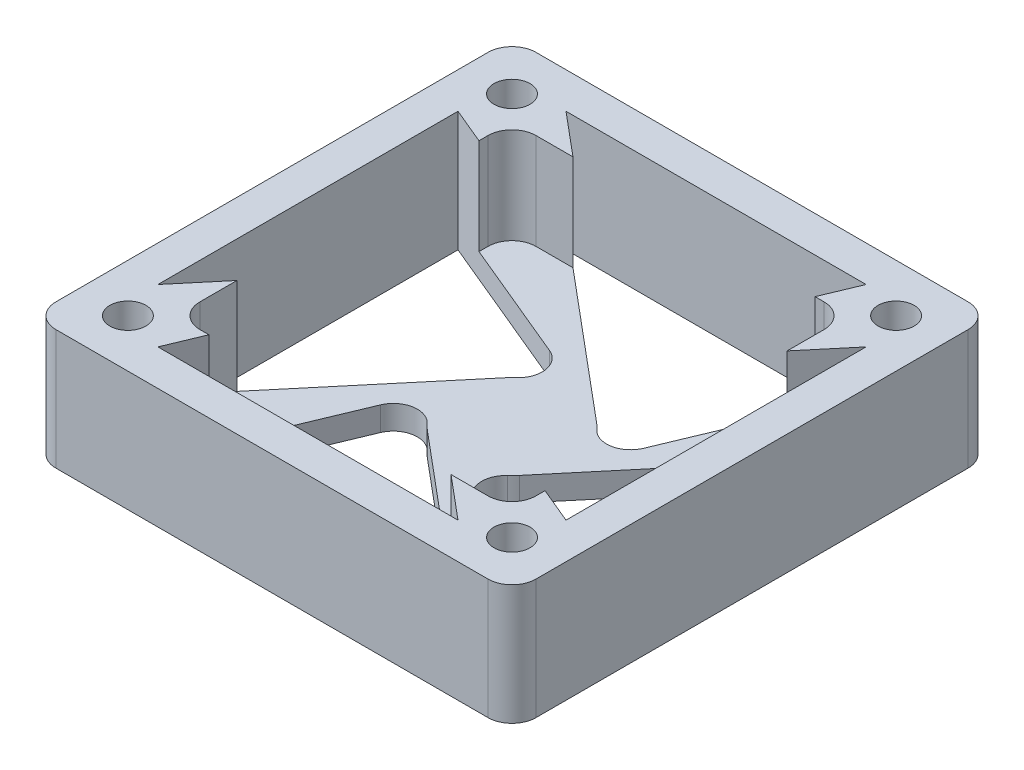
from build123d import *

# Parameters (mm, degrees)
SKETCH_1_W          = 40
SKETCH_1_H          = 40
EXTRUDE_1_DEPTH     = 10
FILLET_1_R          = 2
CUT_EXTRUDE_1_DEPTH = 8
FILLET_2_R          = 2
SKETCH_3_R          = 1.5
SKETCH_3_R_2        = 1.4999999999999978
SKETCH_3_R_3        = 1.500000000000004
SKETCH_3_R_4        = 1.5000000000000042
CUT_EXTRUDE_2_DEPTH = 58.445626465380286
CUT_EXTRUDE_3_DEPTH = 58.445626465380286
FILLET_3_R          = 2


with BuildPart() as part:
    # 草图1 → 凸台-拉伸1 (new body)
    with BuildSketch(Plane(origin=(0, 0, 0), x_dir=(1, 0, 0), z_dir=(0, 1, 0))):
        with Locations((20, 20)):
            Rectangle(SKETCH_1_W, SKETCH_1_H)
    extrude(amount=EXTRUDE_1_DEPTH)

    # 圆角1
    fillet_1_edges = [part.edges().sort_by_distance(p)[0] for p in [
        (0, 5, -40),
        (40, 5, -40),
        (40, 5, 0),
        (0, 5, 0),
    ]]
    fillet(fillet_1_edges, radius=FILLET_1_R)

    # 草图2 → 切除-拉伸1 (cut)
    with BuildSketch(Plane(origin=(0, 10, 0), x_dir=(1, 0, 0), z_dir=(0, 1, 0))):
        Polygon((6, 5.999999999999999), (34, 6), (34, 34), (5.999999999999999, 34), align=None)
    extrude(amount=-CUT_EXTRUDE_1_DEPTH, mode=Mode.SUBTRACT)

    # 圆角2
    fillet_2_edges = [part.edges().sort_by_distance(p)[0] for p in [
        (6, 6, -5.999999999999999),
        (5.999999999999999, 6, -34),
        (34, 6, -34),
        (34, 6, -6),
    ]]
    fillet(fillet_2_edges, radius=FILLET_2_R)

    # 草图3 → 切除-拉伸2 (cut, through all)
    with BuildSketch(Plane(origin=(0, 10, 0), x_dir=(1, 0, 0), z_dir=(0, 1, 0))):
        with Locations(Location((4.0000000000000036, 36.00000000000001, 0), (0, 0, 270))):
            Circle(SKETCH_3_R)
        with Locations(Location((4.0000000000000036, 4, 0), (0, 0, 90))):
            Circle(SKETCH_3_R_2)
        with Locations(Location((36.00000000000001, 4.000000000000004, 0), (0, 0, 270))):
            Circle(SKETCH_3_R_3)
        with Locations(Location((36.00000000000001, 36.00000000000002, 0), (0, 0, 90))):
            Circle(SKETCH_3_R_4)
    extrude(amount=-CUT_EXTRUDE_2_DEPTH, mode=Mode.SUBTRACT)

    # 草图4 → 切除-拉伸3 (cut, through all)
    with BuildSketch(Plane.XZ):
        with BuildLine():
            ThreePointArc((21.923076923076923, -24.615384615384617), (18.815219099044967, -24.857601693915647), (16.167883211678838, -23.211678832116792))
            Line((16.167883211678838, -23.211678832116792), (2.9999999999999947, -7.5))
            Line((2.999999999999995, -7.5), (2.999999999999995, -32.5))
            Line((2.9999999999999964, -32.5), (21.923076923076927, -24.615384615384624))
        make_face()
        with BuildLine():
            Line((7.500000000000055, -2.9999999999999467), (15.38461538461537, -21.923076923076906))
            ThreePointArc((15.384615384615378, -21.923076923076902), (15.14239830608436, -18.815219099044945), (16.788321167883222, -16.167883211678824))
            Line((16.788321167883222, -16.167883211678824), (32.50000000000006, -3.0000000000000355))
            Line((32.50000000000006, -3.000000000000034), (7.500000000000057, -2.9999999999999467))
        make_face()
        with BuildLine():
            Line((37.0000000000001, -7.500000000000116), (18.076923076923116, -15.384615384615365))
            ThreePointArc((18.07692307692312, -15.384615384615369), (21.184780900955076, -15.14239830608436), (23.832116788321194, -16.788321167883236))
            Line((23.832116788321194, -16.788321167883232), (36.99999999999993, -32.50000000000012))
            Line((36.99999999999993, -32.50000000000012), (37.0000000000001, -7.500000000000117))
        make_face()
        with BuildLine():
            ThreePointArc((25.000000000000004, -20), (24.53091569997632, -22.114427326655647), (23.211678832116753, -23.8321167883212))
            Line((23.211678832116757, -23.832116788321205), (7.499999999999826, -36.99999999999988))
            Line((7.499999999999827, -36.99999999999988), (32.49999999999984, -37.00000000000014))
            Line((32.49999999999984, -37.00000000000014), (24.615384615384645, -18.07692307692313))
            ThreePointArc((24.61538461538464, -18.07692307692313), (24.90290337845461, -19.01941932430911), (25.000000000000004, -20))
        make_face()
    extrude(amount=-CUT_EXTRUDE_3_DEPTH, mode=Mode.SUBTRACT)

    # 圆角3
    fillet_3_edges = [part.edges().sort_by_distance(p)[0] for p in [
        (18.076923076923116, 1, -15.384615384615367),
        (15.384615384615376, 1, -21.923076923076906),
        (24.61538461538464, 1, -18.07692307692313),
    ]]
    fillet(fillet_3_edges, radius=FILLET_3_R)
    fillet_3_2_edges = [part.edges().sort_by_distance(p)[0] for p in [
        (21.923076923076927, 1, -24.61538461538462),
    ]]
    fillet(fillet_3_2_edges, radius=FILLET_3_R - 0.0001)  # a hair under: the kernel refuses the full size


solid = part.part
